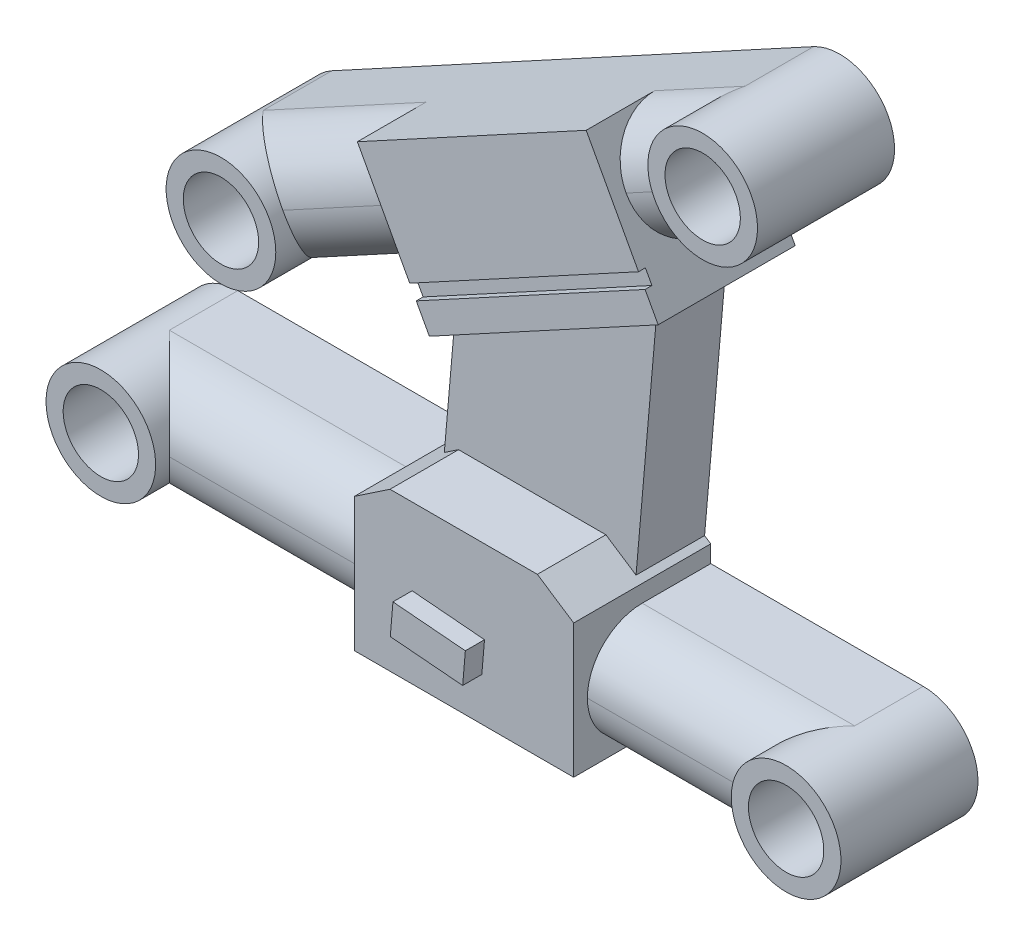
from build123d import *

# Parameters (mm, degrees)
BOSS_EXTRUDE1_DEPTH      = 20
SKETCH2_R                = 8.000000000000012
SKETCH2_R_2              = 5.5000000000000036
BOSS_EXTRUDE2_DEPTH      = 20
SKETCH2_R_3              = 7.999999999999998
SKETCH2_R_4              = 5.4999999999999964
BOSS_EXTRUDE2_2_DEPTH    = 20
BOSS_EXTRUDE3_REACH      = 84.813
BOSS_EXTRUDE3_END_RADIUS = 8.000000000000012
BOSS_EXTRUDE4_REACH      = 79.266
BOSS_EXTRUDE4_END_RADIUS = 7.999999999999998
BOSS_EXTRUDE5_DEPTH      = 10
BOSS_EXTRUDE6_DEPTH      = 20
SKETCH7_R                = 8
SKETCH7_R_2              = 5.499999999999997
BOSS_EXTRUDE7_DEPTH      = 20
SKETCH7_R_3              = 8.000000000000002
SKETCH7_R_4              = 5.500000000000001
BOSS_EXTRUDE7_2_DEPTH    = 20
BOSS_EXTRUDE8_REACH      = 108.8
BOSS_EXTRUDE8_END_RADIUS = 8.000000000000002
BOSS_EXTRUDE9_REACH      = 124.193
BOSS_EXTRUDE9_END_RADIUS = 8
FILLET1_R                = 8
CUT_EXTRUDE1_DEPTH       = 1
BOSS_EXTRUDE10_DEPTH     = 2.8000000000000003
SKETCH12_R               = 5.000000000000001
CUT_EXTRUDE2_DEPTH       = 2
CUT_EXTRUDE3_DEPTH       = 6.999999999999999
CUT_EXTRUDE4_DEPTH       = 2
SKETCH12_7_R             = 1.6049758304520296
SKETCH12_7_R_2           = 1.6000000000000008
CUT_EXTRUDE5_DEPTH       = 8
SKETCH13_W               = 2.8000000000000007
SKETCH13_H               = 5.799999999999997
CUT_EXTRUDE6_DEPTH       = 22.000000000000004
CUT_EXTRUDE7_DEPTH       = 14.499999999999998
CUT_EXTRUDE8_DEPTH       = 14.5


with BuildPart() as part:
    # Sketch1 → Boss-Extrude1 (new body)
    with BuildSketch(Plane.XY):
        Polygon((0, 0), (32, 0), (32, 19.5), (26.699999999999996, 23), (5.2, 22.999999999999996), (-9e-17, 19.5), align=None)
    extrude(amount=BOSS_EXTRUDE1_DEPTH)



with BuildPart() as body_2:
    # Sketch2 → Boss-Extrude2 (new body)
    with BuildSketch(Plane(origin=(0, 0, 0), x_dir=(-1, 0, 0), z_dir=(0, 0, -1))):
        with Locations((-63, 8.999999999999982)):
            Circle(SKETCH2_R)
        with Locations((-63, 8.999999999999982)):
            Circle(SKETCH2_R_2, mode=Mode.SUBTRACT)
    extrude(amount=-BOSS_EXTRUDE2_DEPTH)


with BuildPart() as body_3:
    # Sketch2 → Boss-Extrude2 2 (new body)
    with BuildSketch(Plane(origin=(0, 0, 0), x_dir=(-1, 0, 0), z_dir=(0, 0, -1))):
        with Locations((37.00000000000001, 9.000000000000002)):
            Circle(SKETCH2_R_3)
        with Locations((37.00000000000001, 9.000000000000002)):
            Circle(SKETCH2_R_4, mode=Mode.SUBTRACT)
    extrude(amount=-BOSS_EXTRUDE2_2_DEPTH)


with BuildPart() as part_1:
    add(part.part)

    add(body_2.part)  # Boss-Extrude3 merges body 2
    # Boss-Extrude3: up to this cylinder (the profile starts outside it)
    boss_extrude3_end = Plane(origin=(63, 8.999999999999982, 9), z_dir=(0, 0, -1)) * Cylinder(BOSS_EXTRUDE3_END_RADIUS, 186.62600000000003, mode=Mode.PRIVATE)
    # Sketch4 → Boss-Extrude3 (add, up to the surface)
    with BuildSketch(Plane(origin=(32, 0, 0), x_dir=(0, 0, -1), z_dir=(1, 0, 0)), mode=Mode.PRIVATE) as boss_extrude3_sk1:
        Polygon((0, 17), (-18.000000000000004, 16.999999999999996), (-18, 0.9999999999999974), (2.03e-15, 0.9999999999999996), align=None)
    boss_extrude3_tool1 = extrude(boss_extrude3_sk1.sketch, amount=BOSS_EXTRUDE3_REACH, mode=Mode.PRIVATE) - boss_extrude3_end
    add(boss_extrude3_tool1.solids().sort_by_distance((32, 9, 9))[0])


    add(body_3.part)  # Boss-Extrude4 merges body 3
    # Boss-Extrude4: up to this cylinder (the profile starts outside it)
    boss_extrude4_end = Plane(origin=(-37.00000000000001, 9.000000000000002, 9), z_dir=(0, 0, -1)) * Cylinder(BOSS_EXTRUDE4_END_RADIUS, 175.532, mode=Mode.PRIVATE)
    # Sketch5 → Boss-Extrude4 (add, up to the surface)
    with BuildSketch(Plane.ZY, mode=Mode.PRIVATE) as boss_extrude4_sk1:
        Polygon((0, 17), (18.000000000000004, 17), (18.000000000000007, 1.0000000000000009), (1.96e-15, 1.0000000000000009), align=None)
    boss_extrude4_tool1 = extrude(boss_extrude4_sk1.sketch, amount=BOSS_EXTRUDE4_REACH, mode=Mode.PRIVATE) - boss_extrude4_end
    add(boss_extrude4_tool1.solids().sort_by_distance((0, 9, 9))[0])

    # Sketch6 → Boss-Extrude5 (add)
    with BuildSketch(Plane(origin=(0, 0, 0), x_dir=(-1, 0, 0), z_dir=(0, 0, -1))):
        Polygon((-34.39999999999999, 57.95077896920448), (-31.099999999999998, 20.09433962264151), (-26.699999999999996, 23), (-5.2, 22.999999999999996), (-3.1253837694695172, 21.603623690989096), (-5.978502136601586, 54.33359411944373), (-10.939595247933246, 45.203253371300974), align=None)
    extrude(amount=-BOSS_EXTRUDE5_DEPTH)

    # Sketch6<3> → Boss-Extrude6 (add)
    with BuildSketch(Plane(origin=(0, 0, 0), x_dir=(-1, 0, 0), z_dir=(0, 0, -1))):
        Polygon((-0.4360161035932989, 64.53392395352827), (-10.939595247933246, 45.203253371300974), (-44.328935344507634, 63.34579916606999), (-33.82535620016769, 82.67646974829727), align=None)
    extrude(amount=-BOSS_EXTRUDE6_DEPTH)



with BuildPart() as body_2_2:
    # Sketch7 → Boss-Extrude7 (new body)
    with BuildSketch(Plane.XY.offset(20)):
        with Locations((50.82484219508264, 82.80866622590094)):
            Circle(SKETCH7_R)
        with Locations((50.82484219508264, 82.80866622590094)):
            Circle(SKETCH7_R_2, mode=Mode.SUBTRACT)
    extrude(amount=-BOSS_EXTRUDE7_DEPTH)


with BuildPart() as body_3_2:
    # Sketch7 → Boss-Extrude7 2 (new body)
    with BuildSketch(Plane.XY.offset(20)):
        with Locations((-19.46850537665293, 44.613832973755706)):
            Circle(SKETCH7_R_3)
        with Locations((-19.46850537665293, 44.613832973755706)):
            Circle(SKETCH7_R_4, mode=Mode.SUBTRACT)
    extrude(amount=-BOSS_EXTRUDE7_2_DEPTH)


with BuildPart() as part_2:
    add(part_1.part)

    add(body_3_2.part)  # Boss-Extrude8 merges body 3 2
    # Boss-Extrude8: up to this cylinder (the profile starts outside it)
    boss_extrude8_end = Plane(origin=(-19.46850537665293, 44.613832973755706, 9), z_dir=(0, 0, 1)) * Cylinder(BOSS_EXTRUDE8_END_RADIUS, 234.6, mode=Mode.PRIVATE)
    # Sketch8 → Boss-Extrude8 (add, up to the surface)
    with BuildSketch(Plane(origin=(27.409040149935237, 14.89306960462748, 0), x_dir=(0, 0, 1), z_dir=(-0.8786668446466945, -0.47743541565181535, 0)), mode=Mode.PRIVATE) as boss_extrude8_sk1:
        Polygon((0, 56.49564980326649), (18.000000000000004, 56.49564980326649), (18.000000000000007, 40.49564980326649), (1.65e-15, 40.49564980326649), align=None)
    boss_extrude8_tool1 = extrude(boss_extrude8_sk1.sketch, amount=BOSS_EXTRUDE8_REACH, mode=Mode.PRIVATE) - boss_extrude8_end
    add(boss_extrude8_tool1.solids().sort_by_distance((4.255499, 57.504589, 9))[0])


    add(body_2_2.part)  # Boss-Extrude9 merges body 2 2
    # Boss-Extrude9: up to this cylinder (the profile starts outside it)
    boss_extrude9_end = Plane(origin=(50.82484219508264, 82.80866622590094, 9), z_dir=(0, 0, 1)) * Cylinder(BOSS_EXTRUDE9_END_RADIUS, 265.38599999999997, mode=Mode.PRIVATE)
    # Sketch9 → Boss-Extrude9 (add, up to the surface)
    with BuildSketch(Plane(origin=(60.79838024650963, 33.03561539939651, 0), x_dir=(0, 0, -1), z_dir=(0.8786668446466942, 0.47743541565181585, 0)), mode=Mode.PRIVATE) as boss_extrude9_sk1:
        Polygon((0, 56.49564980326643), (-18.000000000000004, 56.49564980326643), (-18, 40.49564980326643), (1.96e-15, 40.49564980326643), align=None)
    boss_extrude9_tool1 = extrude(boss_extrude9_sk1.sketch, amount=BOSS_EXTRUDE9_REACH, mode=Mode.PRIVATE) - boss_extrude9_end
    add(boss_extrude9_tool1.solids().sort_by_distance((37.64484, 75.647135, 9))[0])

    # Fillet1
    # the kernel refuses this fillet: 8 mm, written as the material it takes off along each edge
    with BuildSketch(Plane(origin=(32, 0.9999999999999974, 18), x_dir=(0, 1e-16, -1), z_dir=(1, 0, 0))) as fillet1_piece_1_section:
        with BuildLine():
            CenterArc((FILLET1_R, FILLET1_R), FILLET1_R, 180, 90)
            Line((7.8e-16, FILLET1_R), (0, 0))
            Line((0, 0), (FILLET1_R, 0))
        make_face()
    fillet1_piece_1 = extrude(amount=51, mode=Mode.PRIVATE)
    fillet1_piece_1 = fillet1_piece_1 - Plane(origin=(63, 8.999999999999982, 16.146124278615087), x_dir=(-1, 0, 0), z_dir=(0, 0, -1)) * Cylinder(8.000000000000012, 134, mode=Mode.PRIVATE)
    add(fillet1_piece_1, mode=Mode.SUBTRACT)
    with BuildSketch(Plane(origin=(32, 16.999999999999996, 18.000000000000004), x_dir=(0, 0, -1), z_dir=(1, 0, 0))) as fillet1_piece_2_section:
        with BuildLine():
            CenterArc((FILLET1_R, -FILLET1_R), FILLET1_R, 90.00000000000001, 89.99999999999999)
            Line((3.55e-15, -FILLET1_R), (0, 0))
            Line((0, 0), (FILLET1_R, 0))
        make_face()
    fillet1_piece_2 = extrude(amount=51, mode=Mode.PRIVATE)
    fillet1_piece_2 = fillet1_piece_2 - Plane(origin=(63, 8.999999999999982, 16.146124278615446), x_dir=(-1, 0, 0), z_dir=(0, 0, -1)) * Cylinder(8.000000000000012, 134, mode=Mode.PRIVATE)
    add(fillet1_piece_2, mode=Mode.SUBTRACT)
    with BuildSketch(Plane(origin=(41.464322850596744, 68.61780023395015, 18), x_dir=(0, 0, -1), z_dir=(0.8786668446466942, 0.47743541565181585, 0))) as fillet1_piece_3_section:
        with BuildLine():
            CenterArc((FILLET1_R, FILLET1_R), FILLET1_R, 180.00000000000009, 89.99999999999989)
            Line((-3.55e-15, FILLET1_R), (0, 0))
            Line((0, 0), (FILLET1_R, 0))
        make_face()
    fillet1_piece_3 = extrude(amount=35, mode=Mode.PRIVATE)
    fillet1_piece_3 = fillet1_piece_3 - Plane(origin=(50.82484219508264, 82.80866622590094, 16.04484502768724), x_dir=(1, 0, 0), z_dir=(0, 0, 1)) * Cylinder(8, 102, mode=Mode.PRIVATE)
    add(fillet1_piece_3, mode=Mode.SUBTRACT)
    with BuildSketch(Plane(origin=(33.82535620016769, 82.67646974829725, 18.000000000000004), x_dir=(0.47743541565181585, -0.8786668446466942, 0), z_dir=(0.8786668446466942, 0.47743541565181585, 0))) as fillet1_piece_4_section:
        with BuildLine():
            CenterArc((FILLET1_R, FILLET1_R), FILLET1_R, 180, 90)
            Line((6.95e-15, FILLET1_R), (0, 0))
            Line((0, 0), (FILLET1_R, 0))
        make_face()
    fillet1_piece_4 = extrude(amount=35.00000000000005, mode=Mode.PRIVATE)
    fillet1_piece_4 = fillet1_piece_4 - Plane(origin=(50.82484219508264, 82.80866622590094, 16.044845027687604), x_dir=(1, 0, 0), z_dir=(0, 0, 1)) * Cylinder(8, 103, mode=Mode.PRIVATE)
    add(fillet1_piece_4, mode=Mode.SUBTRACT)
    with BuildSketch(Plane(origin=(0.4360161035932997, 64.5339239535283, 18.000000000000004), x_dir=(1.28e-15, -2.35e-15, -1), z_dir=(-0.8786668446466945, -0.47743541565181535, 0))) as fillet1_piece_5_section:
        with BuildLine():
            CenterArc((FILLET1_R, FILLET1_R), FILLET1_R, 180, 89.99999999999983)
            Line((1.784e-14, FILLET1_R), (0, 0))
            Line((0, 0), (FILLET1_R, 0))
        make_face()
    fillet1_piece_5 = extrude(amount=47.00000000000002, mode=Mode.PRIVATE)
    fillet1_piece_5 = fillet1_piece_5 - Plane(origin=(-19.46850537665293, 44.613832973755706, 16.13426416613262), x_dir=(1, 0, 0), z_dir=(0, 0, 1)) * Cylinder(8.000000000000002, 127, mode=Mode.PRIVATE)
    add(fillet1_piece_5, mode=Mode.SUBTRACT)
    with BuildSketch(Plane(origin=(8.074982754022347, 50.47525443918118, 18.000000000000007), x_dir=(-0.47743541565181535, 0.8786668446466944, 0), z_dir=(-0.8786668446466945, -0.47743541565181535, 0))) as fillet1_piece_6_section:
        with BuildLine():
            CenterArc((FILLET1_R, FILLET1_R), FILLET1_R, 180, 90)
            Line((-7.94e-15, FILLET1_R), (0, 0))
            Line((0, 0), (FILLET1_R, 0))
        make_face()
    fillet1_piece_6 = extrude(amount=47.00000000000002, mode=Mode.PRIVATE)
    fillet1_piece_6 = fillet1_piece_6 - Plane(origin=(-19.46850537665293, 44.613832973755706, 15.757082069038027), x_dir=(1, 0, 0), z_dir=(0, 0, 1)) * Cylinder(8.000000000000002, 127, mode=Mode.PRIVATE)
    add(fillet1_piece_6, mode=Mode.SUBTRACT)
    with BuildSketch(Plane(origin=(0, 1.0000000000000009, 18.000000000000007), x_dir=(0, -1.1e-16, -1), z_dir=(-1, 0, 0))) as fillet1_piece_7_section:
        with BuildLine():
            CenterArc((FILLET1_R, -FILLET1_R), FILLET1_R, 90, 90)
            Line((-8.9e-16, -FILLET1_R), (0, 0))
            Line((0, 0), (FILLET1_R, 0))
        make_face()
    fillet1_piece_7 = extrude(amount=57.00000000000002, mode=Mode.PRIVATE)
    fillet1_piece_7 = fillet1_piece_7 - Plane(origin=(-37.00000000000001, 9.000000000000002, 16.158452965658498), x_dir=(-1, 0, 0), z_dir=(0, 0, -1)) * Cylinder(7.999999999999998, 147, mode=Mode.PRIVATE)
    add(fillet1_piece_7, mode=Mode.SUBTRACT)
    with BuildSketch(Plane(origin=(-8e-17, 17, 18.000000000000004), x_dir=(0, 0, -1), z_dir=(-1, 0, 0))) as fillet1_piece_8_section:
        with BuildLine():
            CenterArc((FILLET1_R, FILLET1_R), FILLET1_R, 180.00000000000003, 90)
            Line((-3.55e-15, FILLET1_R), (0, 0))
            Line((0, 0), (FILLET1_R, 0))
        make_face()
    fillet1_piece_8 = extrude(amount=57.00000000000001, mode=Mode.PRIVATE)
    fillet1_piece_8 = fillet1_piece_8 - Plane(origin=(-37.00000000000001, 9.000000000000002, 16.1584529656595), x_dir=(-1, 0, 0), z_dir=(0, 0, -1)) * Cylinder(7.999999999999998, 146, mode=Mode.PRIVATE)
    add(fillet1_piece_8, mode=Mode.SUBTRACT)

    # Sketch10 → Cut-Extrude1 (cut)
    with BuildSketch(Plane.XY.offset(20)):
        Polygon((9.02985358532597, 48.71792074988778), (42.41919368190036, 66.86046654465682), (41.46432285059673, 68.6178002339502), (8.074982754022338, 50.47525443918117), align=None)
    extrude(amount=-CUT_EXTRUDE1_DEPTH, mode=Mode.SUBTRACT)

    # Sketch11 → Boss-Extrude10 (add)
    with BuildSketch(Plane.XY.offset(20)):
        Polygon((18.99056603773585, 10.883389375796833), (18.599999999999998, 6.3), (8.038276655772503, 7.2), (8.428842693508352, 11.78338937579684), align=None)
    extrude(amount=BOSS_EXTRUDE10_DEPTH)

    # Sketch12 → Cut-Extrude2 (cut)
    with BuildSketch(Plane(origin=(0, 0, 0), x_dir=(-1, 0, 0), z_dir=(0, 0, -1))):
        with Locations((-22, 9.000000000000002)):
            Circle(SKETCH12_R)
    extrude(amount=-CUT_EXTRUDE2_DEPTH, mode=Mode.SUBTRACT)

    # Sketch12<4> → Cut-Extrude3 (cut)
    with BuildSketch(Plane(origin=(0, 0, 0), x_dir=(-1, 0, 0), z_dir=(0, 0, -1))):
        Polygon((6.356319377041451, 14.028477455220814), (-0.11875000000000302, 13.459727455220813), (0.800000000000002, 3.0000000000000018), (7.275069377041458, 3.568750000000003), (6.8813193770414545, 8.051490337951781), align=None)
        Polygon((-25.602268748509772, 35.32933063302242), (-25.037795064299242, 28.85388706058404), (-9.69009760065465, 30.191767814935158), (-10.254571284865174, 36.66721138737354), (-14.737570681168684, 36.27642191368933), (-21.119269352206267, 35.72012010670664), align=None)
    extrude(amount=-CUT_EXTRUDE3_DEPTH, mode=Mode.SUBTRACT)

    # Sketch12<6> → Cut-Extrude4 (cut)
    with BuildSketch(Plane(origin=(0, 0, 0), x_dir=(-1, 0, 0), z_dir=(0, 0, -1))):
        Polygon((6.8813193770414545, 8.051490337951781), (7.275069377041457, 3.5687500000000023), (16.73863231271742, 4.400000000000003), (16.34488231271742, 8.882740337951782), align=None)
        Polygon((-14.737570681168684, 36.27642191368933), (-10.254571284865174, 36.66721138737354), (-11.079571284865175, 46.13132122401429), (-15.562570681168683, 45.740531750330085), align=None)
        Polygon((-26.427268748509782, 44.79344046966318), (-25.602268748509772, 35.32933063302242), (-21.119269352206267, 35.72012010670663), (-21.944269352206273, 45.18422994334738), align=None)
    extrude(amount=-CUT_EXTRUDE4_DEPTH, mode=Mode.SUBTRACT)

    # Sketch12<7> → Cut-Extrude5 (cut)
    with BuildSketch(Plane(origin=(0, 0, 0), x_dir=(-1, 0, 0), z_dir=(0, 0, -1))):
        with Locations((11.59964197476565, 11.4774838965863)):
            Circle(SKETCH12_7_R)
        with Locations((-18.362630543003274, 40.979381450535236)):
            Circle(SKETCH12_7_R_2)
    extrude(amount=-CUT_EXTRUDE5_DEPTH, mode=Mode.SUBTRACT)

    # Sketch13 → Cut-Extrude6 (cut)
    with BuildSketch(Plane(origin=(1.232797121271193, -0.10746468950636484, 0), x_dir=(0, 0, 1), z_dir=(-0.9962220880674463, 0.0868421052631576, 0))):
        with Locations((5.6000000000000005, 42.39342200955655)):
            Rectangle(SKETCH13_W, SKETCH13_H)
    extrude(amount=-CUT_EXTRUDE6_DEPTH, mode=Mode.SUBTRACT)

    # Sketch14 → Cut-Extrude7 (cut)
    with BuildSketch(Plane.XZ.offset(-1.0000000000000009)):
        Polygon((-15.399999999999999, 7), (-9.600000000000001, 7), (-9.6, 4.2), (-15.399999999999999, 4.2), align=None)
    extrude(amount=-CUT_EXTRUDE7_DEPTH, mode=Mode.SUBTRACT)

    # Sketch15 → Cut-Extrude8 (cut)
    with BuildSketch(Plane.XZ.offset(-1.0000000000000009)):
        Polygon((-9.600000000000001, 7), (-8.100000000000001, 7), (-8.100000000000001, 4.2), (-9.6, 4.2), align=None)
    extrude(amount=-CUT_EXTRUDE8_DEPTH, mode=Mode.SUBTRACT)


solid = part_2.part
